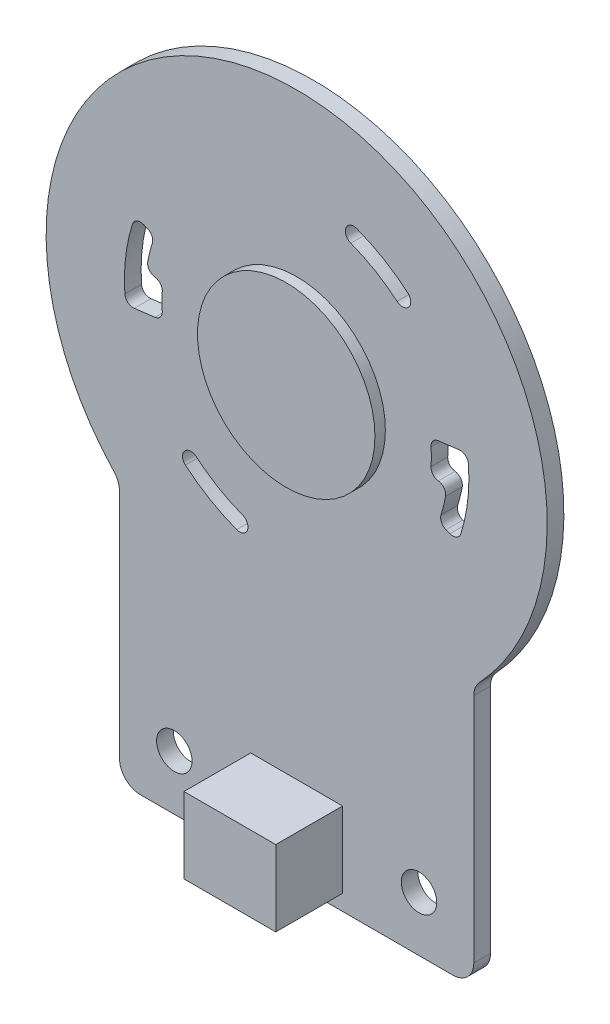
from build123d import *

# Parameters (mm, degrees)
OUTLINE_DEPTH        = 1.6
FILLETS_R            = 0.8
FILLET2_R            = 2
SKETCH3_R            = 8.5
LED_RING_AREA_DEPTH  = 1
SKETCH4_R            = 1.7
MOUNTING_HOLES_DEPTH = 49.37445749
SKETCH5_W            = 8.8
SKETCH5_H            = 7.25
CONNECTOR_AREA_DEPTH = 6.4


with BuildPart() as part:
    # Sketch1 → Outline (new body)
    with BuildSketch(Plane.XY):
        with BuildLine():
            Line((-16.970562748, -16.970562748), (-16.970562748, -39.970562748))
            ThreePointArc((-16.970562748, -39.970562748), (-16.384776311, -41.384776311), (-14.970562748, -41.970562748))
            Line((-14.970562748, -41.970562748), (14.970562748, -41.970562748))
            ThreePointArc((14.970562748, -41.970562748), (16.384776311, -41.384776311), (16.970562748, -39.970562748))
            Line((16.970562748, -39.970562748), (16.970562748, -16.970562748))
            ThreePointArc((16.970562748, -16.970562748), (0, 24), (-16.970562748, -16.970562748))
        make_face()
        with BuildLine():
            Line((16.377011502, 2.010844166), (12.803845356, 1.57211453))
            ThreePointArc((12.803845356, 1.57211453), (12.9, 0), (12.803845356, -1.57211453))
            Line((12.803845356, -1.57211453), (14.391919199, -1.767105479))
            ThreePointArc((14.391919199, -1.767105479), (14.084460012, -3.446445439), (13.581746744, -5.078007028))
            Line((13.581746744, -5.078007028), (15.455091123, -5.778421791))
            ThreePointArc((15.455091123, -5.778421791), (16.38562954, -1.939367058), (16.377011502, 2.010844166))
        make_face(mode=Mode.SUBTRACT)
        with BuildLine():
            Line((-16.377011502, -2.010844166), (-12.803845356, -1.57211453))
            ThreePointArc((-12.803845356, -1.57211453), (-12.9, 0), (-12.803845356, 1.57211453))
            Line((-12.803845356, 1.57211453), (-14.391919199, 1.767105479))
            ThreePointArc((-14.391919199, 1.767105479), (-14.084460012, 3.446445439), (-13.581746744, 5.078007028))
            Line((-13.581746744, 5.078007028), (-15.455091123, 5.778421791))
            ThreePointArc((-15.455091123, 5.778421791), (-16.38562954, 1.939367058), (-16.377011502, -2.010844166))
        make_face(mode=Mode.SUBTRACT)
        with BuildLine():
            ThreePointArc((-9.611831115, -11.254008291), (-7.511567772, -12.752111575), (-5.183069243, -13.862748401))
            ThreePointArc((-5.183069243, -13.862748401), (-4.713897396, -14.892252057), (-5.743401053, -15.361423904))
            ThreePointArc((-5.743401053, -15.361423904), (-8.323629153, -14.130718231), (-10.650947993, -12.470657836))
            ThreePointArc((-10.650947993, -12.470657836), (-10.739714326, -11.342774625), (-9.611831115, -11.254008291))
        make_face(mode=Mode.SUBTRACT)
        with BuildLine():
            ThreePointArc((5.743401053, 15.361423904), (4.713897396, 14.892252057), (5.183069243, 13.862748401))
            ThreePointArc((5.183069243, 13.862748401), (7.511567772, 12.752111575), (9.611831115, 11.254008291))
            ThreePointArc((9.611831115, 11.254008291), (10.739714326, 11.342774625), (10.650947993, 12.470657836))
            ThreePointArc((10.650947993, 12.470657836), (8.323629153, 14.130718231), (5.743401053, 15.361423904))
        make_face(mode=Mode.SUBTRACT)
    extrude(amount=OUTLINE_DEPTH)

    # Fillets
    fillets_edges = [part.edges().sort_by_distance(p)[0] for p in [
        (16.377011502, 2.010844166, 0.8),
        (12.803845356, 1.57211453, 0.8),
        (13.581746744, -5.078007028, 0.8),
        (15.455091123, -5.778421791, 0.8),
        (14.391919199, -1.767105479, 0.8),
        (12.803845356, -1.57211453, 0.8),
        (-12.803845356, -1.57211453, 0.8),
        (-16.377011502, -2.010844166, 0.8),
        (-15.455091123, 5.778421791, 0.8),
        (-13.581746744, 5.078007028, 0.8),
        (-12.803845356, 1.57211453, 0.8),
        (-14.391919199, 1.767105479, 0.8),
    ]]
    fillet(fillets_edges, radius=FILLETS_R - 0.0001)  # a hair under: the kernel refuses the full size

    # Fillet2
    fillet2_edges = [part.edges().sort_by_distance(p)[0] for p in [
        (16.970562748, -16.970562748, 0.8),
        (-16.970562748, -16.970562748, 0.8),
    ]]
    fillet(fillet2_edges, radius=FILLET2_R)

    # Sketch3 → LED Ring Area (add)
    with BuildSketch(Plane.XY.offset(1.6)):
        Circle(SKETCH3_R)
    extrude(amount=LED_RING_AREA_DEPTH)

    # Sketch4 → Mounting Holes (cut, through all)
    with BuildSketch(Plane.XY.offset(1.6)):
        with Locations((-11.720562748, -36.720562748)):
            Circle(SKETCH4_R)
        with Locations((11.720562748, -36.720562748)):
            Circle(SKETCH4_R)
    extrude(amount=-MOUNTING_HOLES_DEPTH, mode=Mode.SUBTRACT)

    # Sketch5 → Connector Area (add)
    with BuildSketch(Plane.XY.offset(1.6)):
        with Locations((0, -36.845562748)):
            Rectangle(SKETCH5_W, SKETCH5_H)
    extrude(amount=CONNECTOR_AREA_DEPTH)


solid = part.part
